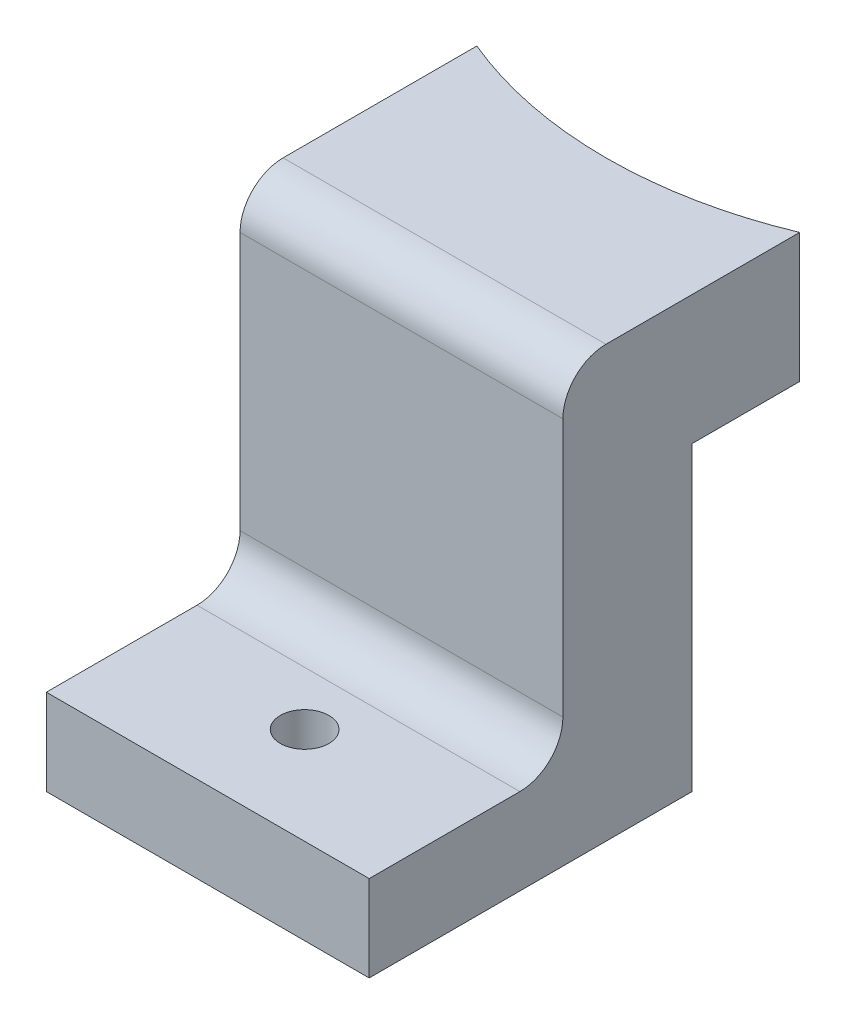
from build123d import *

# Parameters (mm, degrees)
SKETCH1_W                 = 15
SKETCH1_H                 = 10
BOSS_EXTRUDE1_DEPTH       = 6
SKETCH2_R                 = 19.5
CUT_EXTRUDE1_DEPTH        = 9
SKETCH3_W                 = 15
SKETCH3_H                 = 6
BOSS_EXTRUDE2_DEPTH       = 20
SKETCH4_W                 = 15
SKETCH4_H                 = 4
BOSS_EXTRUDE3_DEPTH       = 9
F_4_40_TAPPED_HOLE2_D     = 2.2606
F_4_40_TAPPED_HOLE2_DEPTH = 7.6
F_4_40_TAPPED_HOLE2_TIP   = 0.679152758
FILLET2_R                 = 2


with BuildPart() as part:
    # Sketch1 → Boss-Extrude1 (new body)
    with BuildSketch(Plane(origin=(0, 0, 0), x_dir=(1, 0, 0), z_dir=(0, 1, 0))):
        Rectangle(SKETCH1_W, SKETCH1_H)
    extrude(amount=BOSS_EXTRUDE1_DEPTH)

    # Sketch2 → Cut-Extrude1 (cut)
    with BuildSketch(Plane(origin=(0, 6, 0), x_dir=(1, 0, 0), z_dir=(0, 1, 0))):
        with Locations((0, 23)):
            Circle(SKETCH2_R)
    extrude(amount=-CUT_EXTRUDE1_DEPTH, mode=Mode.SUBTRACT)

    # Sketch3 → Boss-Extrude2 (add)
    with BuildSketch(Plane(origin=(0, 6, 0), x_dir=(1, 0, 0), z_dir=(0, 1, 0))):
        with Locations((0, -3)):
            Rectangle(SKETCH3_W, SKETCH3_H)
    extrude(amount=-BOSS_EXTRUDE2_DEPTH)

    # Sketch4 → Boss-Extrude3 (add)
    with BuildSketch(Plane.XY.offset(6)):
        with Locations((0, -12)):
            Rectangle(SKETCH4_W, SKETCH4_H)
    extrude(amount=BOSS_EXTRUDE3_DEPTH)

    # #4-40 Tapped Hole2
    with Locations(Plane(origin=(0, -14, 0), x_dir=(-1, 0, 0), z_dir=(0, -1, 0))):
        with Locations((0, -10.5)):
            Hole(F_4_40_TAPPED_HOLE2_D / 2, depth=F_4_40_TAPPED_HOLE2_DEPTH)
            with Locations((0, 0, -(F_4_40_TAPPED_HOLE2_DEPTH + F_4_40_TAPPED_HOLE2_TIP / 2))):  # 118° drill point
                Cone(0, F_4_40_TAPPED_HOLE2_D / 2, F_4_40_TAPPED_HOLE2_TIP, mode=Mode.SUBTRACT)

    # Fillet2
    fillet2_edges = [part.edges().sort_by_distance(p)[0] for p in [
        (0, 6, 6),
        (0, -10, 6),
    ]]
    fillet(fillet2_edges, radius=FILLET2_R)


solid = part.part
